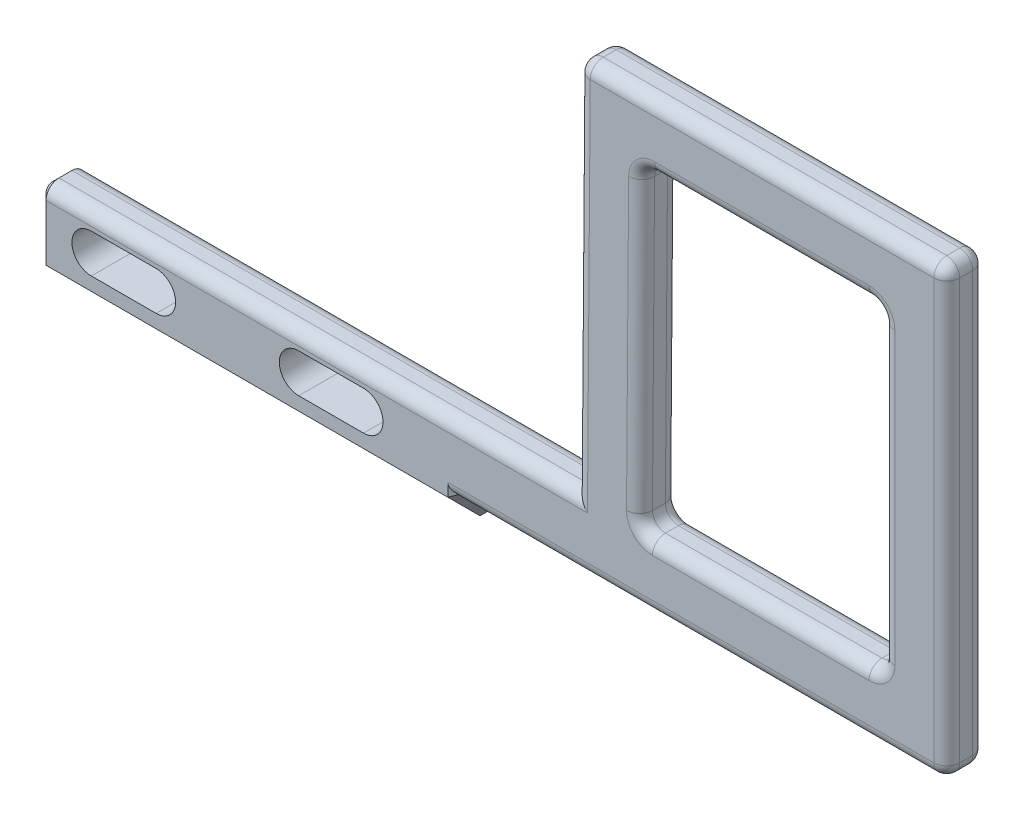
from build123d import *
from OCP.BRepFilletAPI import BRepFilletAPI_MakeChamfer

# Parameters (mm, degrees)
RESSALTO_EXTRUS_O1_DEPTH = 3
RESSALTO_EXTRUS_O2_DEPTH = 32
FILETE1_R                = 1
CHANFRO1_SIZE            = 0.5
CHANFRO1_SIZE_2          = 0.499987399
CHANFRO1_SIZE_3          = 0.499991089
FILETE10_R               = 0.4


with BuildPart() as part:
    # Esboço1 → Ressalto-extrusão1 (new body)
    with BuildSketch(Plane.XY):
        Polygon((5.893734702, -9.900463955), (6.106086441, 19.167541422), (34.606086441, 19.167541422), (34.606086441, -15.232458579), (-35.393913559, -15.232458579), (-35.393913559, -9.89942335), align=None)
        Polygon((10.891442786, -10.232458579), (11.069693146, 14.167541422), (29.606086441, 14.167541422), (29.606086441, -10.232458579), align=None, mode=Mode.SUBTRACT)
        with BuildLine():
            Line((-31.393913559, -11.201458579), (-26.393913559, -11.201458579))
            ThreePointArc((-26.393913559, -11.201458579), (-24.893913559, -12.701458579), (-26.393913559, -14.201458579))
            Line((-26.393913559, -14.201458579), (-31.393913559, -14.201458579))
            ThreePointArc((-31.393913559, -14.201458579), (-32.893913559, -12.701458579), (-31.393913559, -11.201458579))
        make_face(mode=Mode.SUBTRACT)
        with BuildLine():
            Line((-15.393913559, -11.201458579), (-10.393913559, -11.201458579))
            ThreePointArc((-10.393913559, -11.201458579), (-8.893913559, -12.701458579), (-10.393913559, -14.201458579))
            Line((-10.393913559, -14.201458579), (-15.393913559, -14.201458579))
            ThreePointArc((-15.393913559, -14.201458579), (-16.893913559, -12.701458579), (-15.393913559, -11.201458579))
        make_face(mode=Mode.SUBTRACT)
    extrude(amount=RESSALTO_EXTRUS_O1_DEPTH)

    # Esboço2 → Ressalto-extrusão2 (add)
    with BuildSketch(Plane.ZY.offset(35.393913559)):
        Polygon((0, -15.232458579), (-2.486055277, -17.718513856), (0.513944723, -17.718513856), (3, -15.232458579), align=None)
    extrude(amount=-RESSALTO_EXTRUS_O2_DEPTH)

    # Filete1
    filete1_edges = [part.edges().sort_by_distance(p)[0] for p in [
        (5.999910572, 4.633538733, 0),
        (20.356086441, 19.167541422, 0),
        (34.606086441, 1.967541422, 0),
        (-14.750089428, -9.899943653, 0),
        (29.606086441, 1.967541422, 0),
        (20.337889794, 14.167541422, 0),
        (10.980567966, 1.967541422, 0),
        (20.248764614, -10.232458579, 0),
        (6.106086441, 19.167541422, 1.5),
        (34.606086441, 19.167541422, 1.5),
        (34.606086441, -15.232458579, 1.5),
        (29.606086441, -10.232458579, 1.5),
        (29.606086441, 14.167541422, 1.5),
        (11.069693146, 14.167541422, 1.5),
        (10.891442786, -10.232458579, 1.5),
        (20.248764614, -10.232458579, 3),
        (10.980567966, 1.967541422, 3),
        (15.606086441, -15.232458579, 0),
        (15.606086441, -15.232458579, 3),
        (20.337889794, 14.167541422, 3),
        (29.606086441, 1.967541422, 3),
        (-14.750089428, -9.899943653, 3),
        (34.606086441, 1.967541422, 3),
        (20.356086441, 19.167541422, 3),
        (5.999910572, 4.633538733, 3),
    ]]
    fillet(filete1_edges, radius=FILETE1_R)

    # Chanfro1
    chanfro1_edges_1 = [part.edges().sort_by_distance(p)[0] for p in [
        (-35.393913559, -9.89942335, 1.5),
    ]]
    chanfro1_side_1 = [part.faces().sort_by_distance(p)[0] for p in [
        (-35.383913811, -9.899423602, 1.5),
    ]]
    chanfro1_edges_2 = [part.edges().sort_by_distance(p)[0] for p in [
        (-35.393895737, -10.19231657, 0.292893219),
    ]]
    chanfro1_side_2 = [part.faces().sort_by_distance(p)[0] for p in [
        (-35.393895737, -10.199387512, 0.299964161),
    ]]
    chanfro1_edges_3 = [part.edges().sort_by_distance(p)[0] for p in [
        (-35.393895737, -10.19231657, 2.707106781),
    ]]
    chanfro1_side_3 = [part.faces().sort_by_distance(p)[0] for p in [
        (-35.393895737, -10.199387512, 2.700035839),
    ]]
    chanfro1_edges_4 = [part.edges().sort_by_distance(p)[0] for p in [
        (-35.393913559, -13.065940965, 0),
        (-35.393913559, -13.065940965, 3),
    ]]
    chanfro1 = BRepFilletAPI_MakeChamfer(part.part.solid().wrapped)
    for e in chanfro1_edges_1:
        chanfro1.Add(CHANFRO1_SIZE, CHANFRO1_SIZE_2, e.wrapped, chanfro1_side_1[0].wrapped)
    for e in chanfro1_edges_2:
        chanfro1.Add(CHANFRO1_SIZE, CHANFRO1_SIZE_3, e.wrapped, chanfro1_side_2[0].wrapped)
    for e in chanfro1_edges_3:
        chanfro1.Add(CHANFRO1_SIZE, CHANFRO1_SIZE_3, e.wrapped, chanfro1_side_3[0].wrapped)
    for e in chanfro1_edges_4:
        chanfro1.Add(CHANFRO1_SIZE, e.wrapped)
    add(Compound.cast(chanfro1.Shape()), mode=Mode.REPLACE)
    chanfro1_2_edges = [part.edges().sort_by_distance(p)[0] for p in [
        (-35.393913559, -16.475486217, -1.243027639),
    ]]
    chamfer(chanfro1_2_edges, length=CHANFRO1_SIZE)
    chanfro1_3_edges = [part.edges().sort_by_distance(p)[0] for p in [
        (-35.393913559, -16.725479917, 1.506978662),
    ]]
    chamfer(chanfro1_3_edges, length=CHANFRO1_SIZE)
    chanfro1_4_edges = [part.edges().sort_by_distance(p)[0] for p in [
        (-35.393913559, -17.718513856, -0.986055277),
    ]]
    chamfer(chanfro1_4_edges, length=CHANFRO1_SIZE)
    chanfro1_5_edges = [part.edges().sort_by_distance(p)[0] for p in [
        (-3.393913559, -14.732458579, 3),
    ]]
    chamfer(chanfro1_5_edges, length=CHANFRO1_SIZE)
    chanfro1_6_edges = [part.edges().sort_by_distance(p)[0] for p in [
        (-3.393913559, -16.475486217, -1.243027639),
    ]]
    chamfer(chanfro1_6_edges, length=CHANFRO1_SIZE)
    chanfro1_7_edges = [part.edges().sort_by_distance(p)[0] for p in [
        (-3.393913559, -16.725486217, 1.506972361),
    ]]
    chamfer(chanfro1_7_edges, length=CHANFRO1_SIZE)
    chanfro1_8_edges = [part.edges().sort_by_distance(p)[0] for p in [
        (-3.393913559, -17.718513856, -0.986055277),
    ]]
    chamfer(chanfro1_8_edges, length=CHANFRO1_SIZE)
    chanfro1_9_edges = [part.edges().sort_by_distance(p)[0] for p in [
        (-3.393913559, -14.732458579, 0),
    ]]
    chamfer(chanfro1_9_edges, length=CHANFRO1_SIZE)

    # Filete10
    filete10_edges = [part.edges().sort_by_distance(p)[0] for p in [
        (-19.393913559, -17.718513856, -2.486055277),
    ]]
    fillet(filete10_edges, radius=FILETE10_R)


solid = part.part
